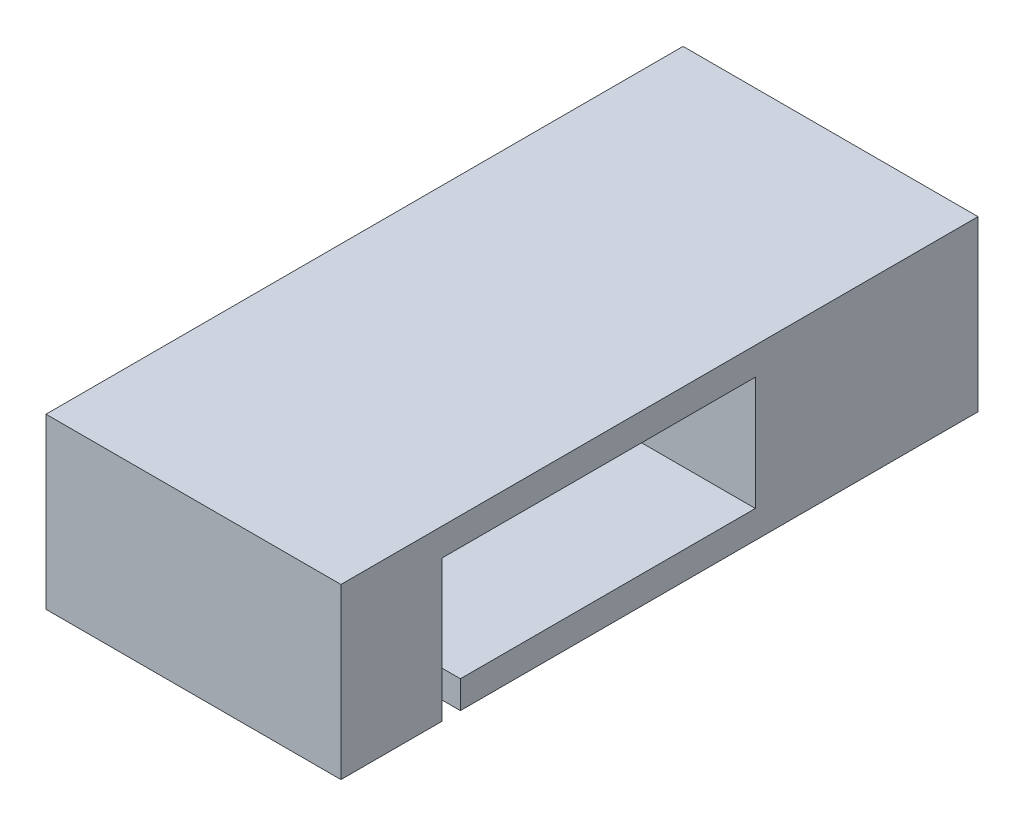
from build123d import *

# Parameters (mm, degrees)
SKETCH2_W           = 32
SKETCH2_H           = 69.12
BOSS_EXTRUDE1_DEPTH = 18.34
CUT_EXTRUDE1_DEPTH  = 29
SKETCH4_R           = 2.305
BOSS_EXTRUDE3_DEPTH = 6


with BuildPart() as part:
    # Sketch2 → Boss-Extrude1 (new body)
    with BuildSketch(Plane(origin=(0, 0, 0), x_dir=(1, 0, 0), z_dir=(0, 1, 0))):
        Rectangle(SKETCH2_W, SKETCH2_H)
    extrude(amount=BOSS_EXTRUDE1_DEPTH)

    # Sketch3 → Cut-Extrude1 (cut)
    with BuildSketch(Plane(origin=(16, 0, 0), x_dir=(0, 0, -1), z_dir=(1, 0, 0))):
        Polygon((-23.6, 15.34), (10.4, 15.34), (10.4, 3), (-21.6, 3), (-21.6, 0), (-23.6, 0), (-23.6, 3), align=None)
    extrude(amount=-CUT_EXTRUDE1_DEPTH, mode=Mode.SUBTRACT)

    # Sketch4 → Boss-Extrude3 (add)
    with BuildSketch(Plane.ZY.offset(16)):
        with Locations((0, 9.17)):
            Circle(SKETCH4_R)
    extrude(amount=BOSS_EXTRUDE3_DEPTH)


solid = part.part
